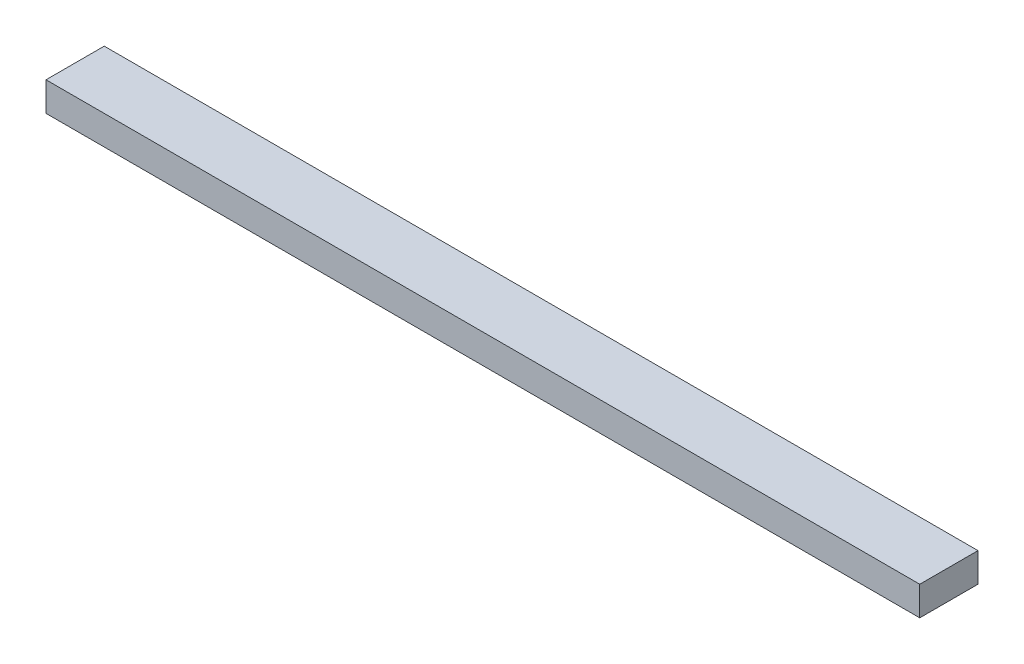
from build123d import *

# Parameters (mm, degrees)
SKETCH_1_W      = 150
SKETCH_1_H      = 10
EXTRUDE_1_DEPTH = 5


with BuildPart() as part:
    # 草图1 → 凸台-拉伸1 (new body)
    with BuildSketch(Plane(origin=(0, 0, 0), x_dir=(1, 0, 0), z_dir=(0, 1, 0))):
        with Locations((75, -5)):
            Rectangle(SKETCH_1_W, SKETCH_1_H)
    extrude(amount=EXTRUDE_1_DEPTH)


solid = part.part
